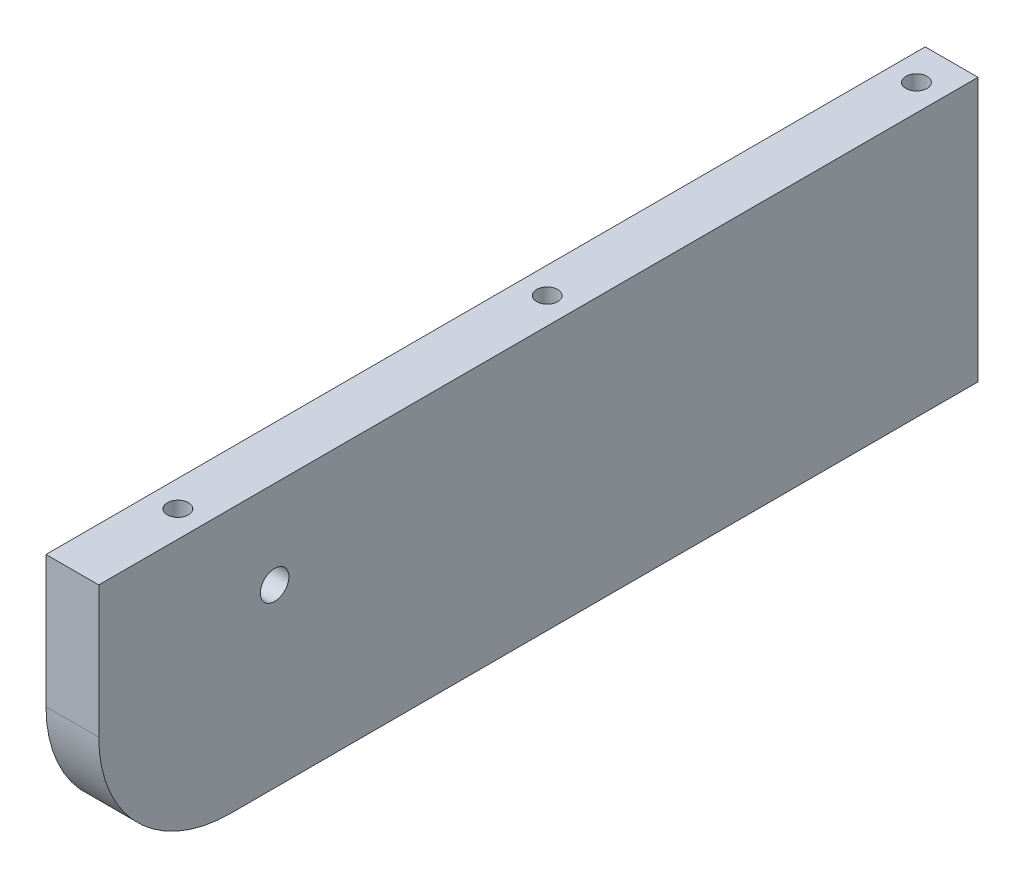
from build123d import *

# Parameters (mm, degrees)
SKETCH1_W                      = 100
SKETCH1_H                      = 30
SKETCH1_R                      = 1.625
BOSS_EXTRUDE1_DEPTH            = 6
FILLET1_R                      = 15
CBORE_FOR_M2_SHCS1_D           = 2.4
CBORE_FOR_M2_SHCS1_DEPTH       = 20
CBORE_FOR_M2_SHCS1_CBORE_D     = 4.4
CBORE_FOR_M2_SHCS1_CBORE_DEPTH = 2
CBORE_FOR_M2_SHCS1_TIP         = 0.721032743


with BuildPart() as part:
    # Sketch1 → Boss-Extrude1 (new body)
    with BuildSketch(Plane(origin=(0, 0, 0), x_dir=(0, 0, -1), z_dir=(1, 0, 0))):
        Rectangle(SKETCH1_W, SKETCH1_H)
        with Locations((-30, 5)):
            Circle(SKETCH1_R, mode=Mode.SUBTRACT)
    extrude(amount=BOSS_EXTRUDE1_DEPTH)

    # Fillet1
    fillet1_edges = [part.edges().sort_by_distance(p)[0] for p in [
        (3, -15, 50),
    ]]
    fillet(fillet1_edges, radius=FILLET1_R)

    # CBORE for M2 SHCS1
    with Locations(Plane(origin=(-724.293536786, 25, -1323.282701689), x_dir=(1, 0, 0), z_dir=(0, 1, 0))):
        with Locations((727.293536786, -1277.282701689), (727.293536786, -1361.282701689), (625.293536786, -1277.282701689), (625.293536786, -1361.282701689), (625.293536786, -1319.282701689), (727.293536786, -1319.282701689)):
            CounterBoreHole(CBORE_FOR_M2_SHCS1_D / 2, CBORE_FOR_M2_SHCS1_CBORE_D / 2, CBORE_FOR_M2_SHCS1_CBORE_DEPTH, depth=CBORE_FOR_M2_SHCS1_DEPTH)
            with Locations((0, 0, -(CBORE_FOR_M2_SHCS1_DEPTH + CBORE_FOR_M2_SHCS1_TIP / 2))):  # 118° drill point
                Cone(0, CBORE_FOR_M2_SHCS1_D / 2, CBORE_FOR_M2_SHCS1_TIP, mode=Mode.SUBTRACT)


solid = part.part
